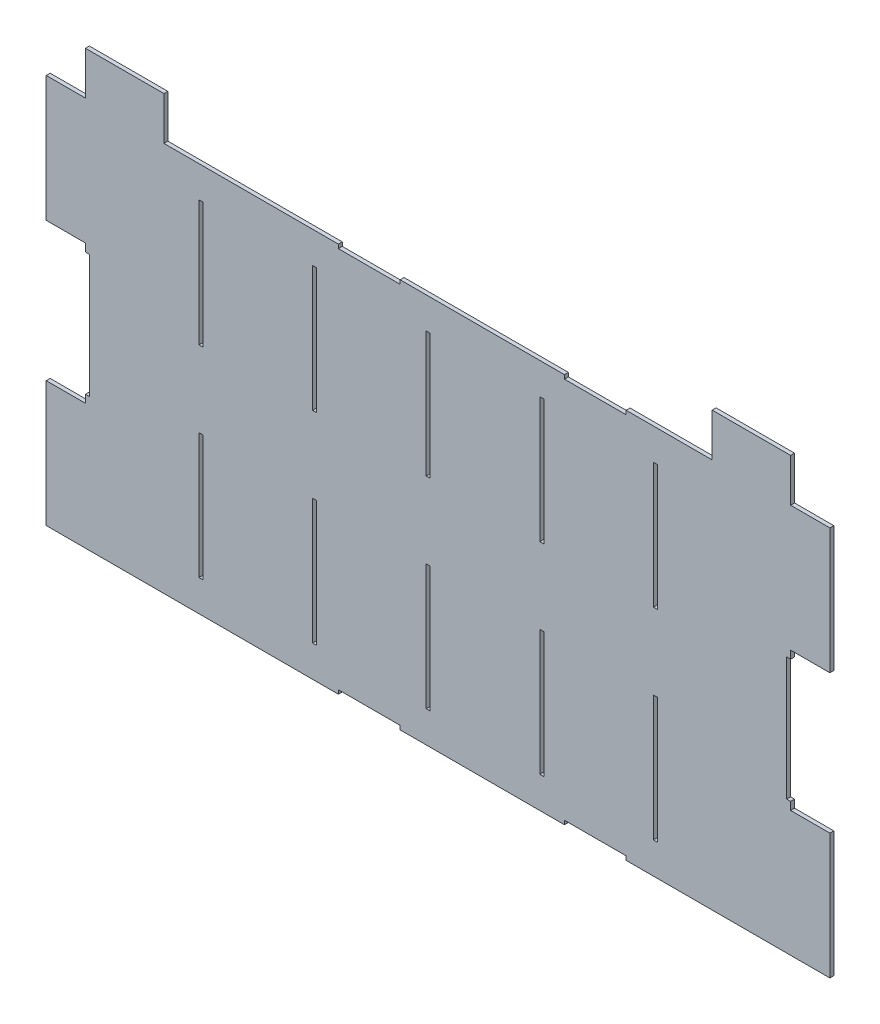
from build123d import *

# Parameters (mm, degrees)
SKETCH1_W                 = 570.860988324
SKETCH1_H                 = 315.575
BOSS_EXTRUDE1_DEPTH       = 3.175
SKETCH2_W                 = 3.175
SKETCH2_H                 = 101.6
CUT_EXTRUDE1_DEPTH        = 3.175
SKETCH7_W                 = 50
SKETCH7_H                 = 3.175
CUT_EXTRUDE5_DEPTH        = 3.175
LPATTERN2_COPY_1_SKETCH_W = 3.175
LPATTERN2_COPY_1_SKETCH_H = 101.6
LPATTERN2_COPY_1_DEPTH    = 3.175
LPATTERN2_COPY_2_SKETCH_W = 3.175
LPATTERN2_COPY_2_SKETCH_H = 101.6
LPATTERN2_COPY_2_DEPTH    = 3.175
LPATTERN2_COPY_3_SKETCH_W = 3.175
LPATTERN2_COPY_3_SKETCH_H = 101.6
LPATTERN2_COPY_3_DEPTH    = 3.175
LPATTERN2_COPY_4_SKETCH_W = 3.175
LPATTERN2_COPY_4_SKETCH_H = 101.6
LPATTERN2_COPY_4_DEPTH    = 3.175
LPATTERN2_COPY_5_SKETCH_W = 3.175
LPATTERN2_COPY_5_SKETCH_H = 101.6
LPATTERN2_COPY_5_DEPTH    = 3.175
LPATTERN2_COPY_6_SKETCH_W = 3.175
LPATTERN2_COPY_6_SKETCH_H = 101.6
LPATTERN2_COPY_6_DEPTH    = 3.175
LPATTERN2_COPY_7_SKETCH_W = 3.175
LPATTERN2_COPY_7_SKETCH_H = 101.6
LPATTERN2_COPY_7_DEPTH    = 3.175
LPATTERN2_COPY_8_SKETCH_W = 3.175
LPATTERN2_COPY_8_SKETCH_H = 101.6
LPATTERN2_COPY_8_DEPTH    = 3.175
SKETCH9_W                 = 63.5
SKETCH9_H                 = 34.925
SKETCH9_W_2               = 31.75
SKETCH9_H_2               = 101.6
BOSS_EXTRUDE3_DEPTH       = 3.175
SKETCH10_W                = 3.175
SKETCH10_H                = 99.675
CUT_EXTRUDE6_DEPTH        = 372.149099633


with BuildPart() as part:
    # Sketch1 → Boss-Extrude1 (new body)
    with BuildSketch(Plane.XY):
        Rectangle(SKETCH1_W, SKETCH1_H)
    extrude(amount=BOSS_EXTRUDE1_DEPTH)

    # Sketch2 → Cut-Extrude1 (cut)
    with BuildSketch(Plane.XY.offset(3.175)):
        with Locations((-191.887994162, -81.5875)):
            Rectangle(SKETCH2_W, SKETCH2_H)
    cut_extrude1 = extrude(amount=-CUT_EXTRUDE1_DEPTH, mode=Mode.SUBTRACT)

    # Sketch7 → Cut-Extrude5 (cut)
    with BuildSketch(Plane.XY.offset(3.175)):
        with Locations((127.304934912, -156.2)):
            Rectangle(SKETCH7_W, SKETCH7_H)
        with Locations((-55.695065088, -156.2)):
            Rectangle(SKETCH7_W, SKETCH7_H)
    cut_extrude5 = extrude(amount=-CUT_EXTRUDE5_DEPTH, mode=Mode.SUBTRACT)

    # Mirror3: Cut-Extrude1 across plane
    add(cut_extrude1.mirror(Plane.ZX), mode=Mode.SUBTRACT)

    # LPattern2 copy 1 sketch → LPattern2 copy 1 (cut)
    with BuildSketch(Plane(origin=(91.96, 0, 3.175), x_dir=(1, 0, 0), z_dir=(0, 0, 1))):
        with Locations((-191.887994162, 81.5875)):
            Rectangle(LPATTERN2_COPY_1_SKETCH_W, LPATTERN2_COPY_1_SKETCH_H)
    extrude(amount=-LPATTERN2_COPY_1_DEPTH, mode=Mode.SUBTRACT)

    # LPattern2 copy 2 sketch → LPattern2 copy 2 (cut)
    with BuildSketch(Plane(origin=(183.92, 0, 3.175), x_dir=(1, 0, 0), z_dir=(0, 0, 1))):
        with Locations((-191.887994162, 81.5875)):
            Rectangle(LPATTERN2_COPY_2_SKETCH_W, LPATTERN2_COPY_2_SKETCH_H)
    extrude(amount=-LPATTERN2_COPY_2_DEPTH, mode=Mode.SUBTRACT)

    # LPattern2 copy 3 sketch → LPattern2 copy 3 (cut)
    with BuildSketch(Plane(origin=(275.88, 0, 3.175), x_dir=(1, 0, 0), z_dir=(0, 0, 1))):
        with Locations((-191.887994162, 81.5875)):
            Rectangle(LPATTERN2_COPY_3_SKETCH_W, LPATTERN2_COPY_3_SKETCH_H)
    extrude(amount=-LPATTERN2_COPY_3_DEPTH, mode=Mode.SUBTRACT)

    # LPattern2 copy 4 sketch → LPattern2 copy 4 (cut)
    with BuildSketch(Plane(origin=(367.84, 0, 3.175), x_dir=(1, 0, 0), z_dir=(0, 0, 1))):
        with Locations((-191.887994162, 81.5875)):
            Rectangle(LPATTERN2_COPY_4_SKETCH_W, LPATTERN2_COPY_4_SKETCH_H)
    extrude(amount=-LPATTERN2_COPY_4_DEPTH, mode=Mode.SUBTRACT)

    # LPattern2 copy 5 sketch → LPattern2 copy 5 (cut)
    with BuildSketch(Plane(origin=(91.96, 0, 3.175), x_dir=(1, 0, 0), z_dir=(0, 0, 1))):
        with Locations((-191.887994162, -81.5875)):
            Rectangle(LPATTERN2_COPY_5_SKETCH_W, LPATTERN2_COPY_5_SKETCH_H)
    extrude(amount=-LPATTERN2_COPY_5_DEPTH, mode=Mode.SUBTRACT)

    # LPattern2 copy 6 sketch → LPattern2 copy 6 (cut)
    with BuildSketch(Plane(origin=(183.92, 0, 3.175), x_dir=(1, 0, 0), z_dir=(0, 0, 1))):
        with Locations((-191.887994162, -81.5875)):
            Rectangle(LPATTERN2_COPY_6_SKETCH_W, LPATTERN2_COPY_6_SKETCH_H)
    extrude(amount=-LPATTERN2_COPY_6_DEPTH, mode=Mode.SUBTRACT)

    # LPattern2 copy 7 sketch → LPattern2 copy 7 (cut)
    with BuildSketch(Plane(origin=(275.88, 0, 3.175), x_dir=(1, 0, 0), z_dir=(0, 0, 1))):
        with Locations((-191.887994162, -81.5875)):
            Rectangle(LPATTERN2_COPY_7_SKETCH_W, LPATTERN2_COPY_7_SKETCH_H)
    extrude(amount=-LPATTERN2_COPY_7_DEPTH, mode=Mode.SUBTRACT)

    # LPattern2 copy 8 sketch → LPattern2 copy 8 (cut)
    with BuildSketch(Plane(origin=(367.84, 0, 3.175), x_dir=(1, 0, 0), z_dir=(0, 0, 1))):
        with Locations((-191.887994162, -81.5875)):
            Rectangle(LPATTERN2_COPY_8_SKETCH_W, LPATTERN2_COPY_8_SKETCH_H)
    extrude(amount=-LPATTERN2_COPY_8_DEPTH, mode=Mode.SUBTRACT)

    # Sketch9 → Boss-Extrude3 (add)
    with BuildSketch(Plane(origin=(0, 0, 0), x_dir=(-1, 0, 0), z_dir=(0, 0, -1))):
        with Locations((-253.680494162, 175.25)):
            Rectangle(SKETCH9_W, SKETCH9_H)
        Polygon((-285.430494162, 56.1875), (-285.430494162, 157.7875), (-301.305494162, 157.7875), (-317.180494162, 157.7875), (-317.180494162, 56.1875), align=None)
        with Locations((-301.305494162, -106.9875)):
            Rectangle(SKETCH9_W_2, SKETCH9_H_2)
    boss_extrude3 = extrude(amount=-BOSS_EXTRUDE3_DEPTH)

    # Mirror4: Boss-Extrude3 across plane
    add(boss_extrude3.mirror(Plane(origin=(0, 0, 0), x_dir=(0, 0, 1), z_dir=(1, 0, 0))))

    # Mirror5: Cut-Extrude5 across plane
    add(cut_extrude5.mirror(Plane.ZX), mode=Mode.SUBTRACT)

    # Sketch10 → Cut-Extrude6 (cut, through all)
    with BuildSketch(Plane(origin=(0, 0, 0), x_dir=(-1, 0, 0), z_dir=(0, 0, -1))):
        with Locations((-283.842994162, 0)):
            Rectangle(SKETCH10_W, SKETCH10_H)
    cut_extrude6 = extrude(amount=-CUT_EXTRUDE6_DEPTH, mode=Mode.SUBTRACT)

    # Mirror6: Cut-Extrude6 across plane
    add(cut_extrude6.mirror(Plane(origin=(0, 0, 0), x_dir=(0, 0, 1), z_dir=(1, 0, 0))), mode=Mode.SUBTRACT)


solid = part.part
